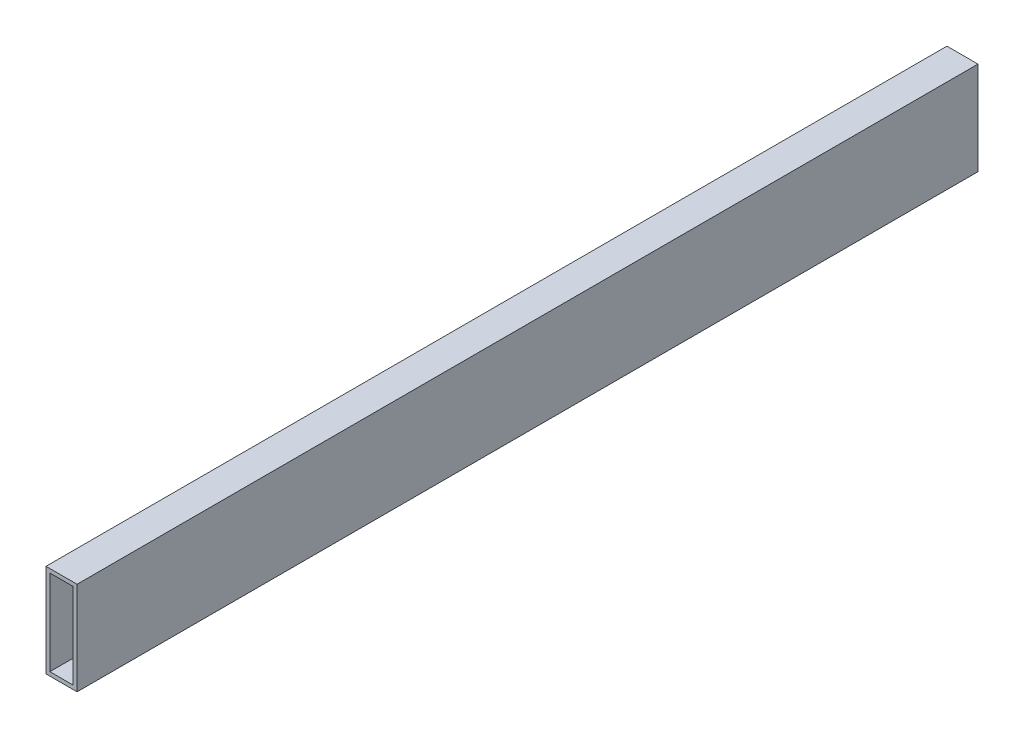
from build123d import *

# Parameters (mm, degrees)
SKETCH1_W           = 25.4
SKETCH1_H           = 76.2
BOSS_EXTRUDE1_DEPTH = 368.3
SHELL1_T            = -3.175


with BuildPart() as part:
    # Sketch1 → Boss-Extrude1 (new, symmetric)
    with BuildSketch(Plane.XY):
        Rectangle(SKETCH1_W, SKETCH1_H)
    extrude(amount=BOSS_EXTRUDE1_DEPTH, both=True)

    # Shell1
    shell1_openings = [part.faces().sort_by_distance(p)[0] for p in [
        (0, 0, -368.3),
        (0, 0, 368.3),
    ]]
    offset(amount=SHELL1_T, openings=shell1_openings, kind=Kind.INTERSECTION)


solid = part.part
